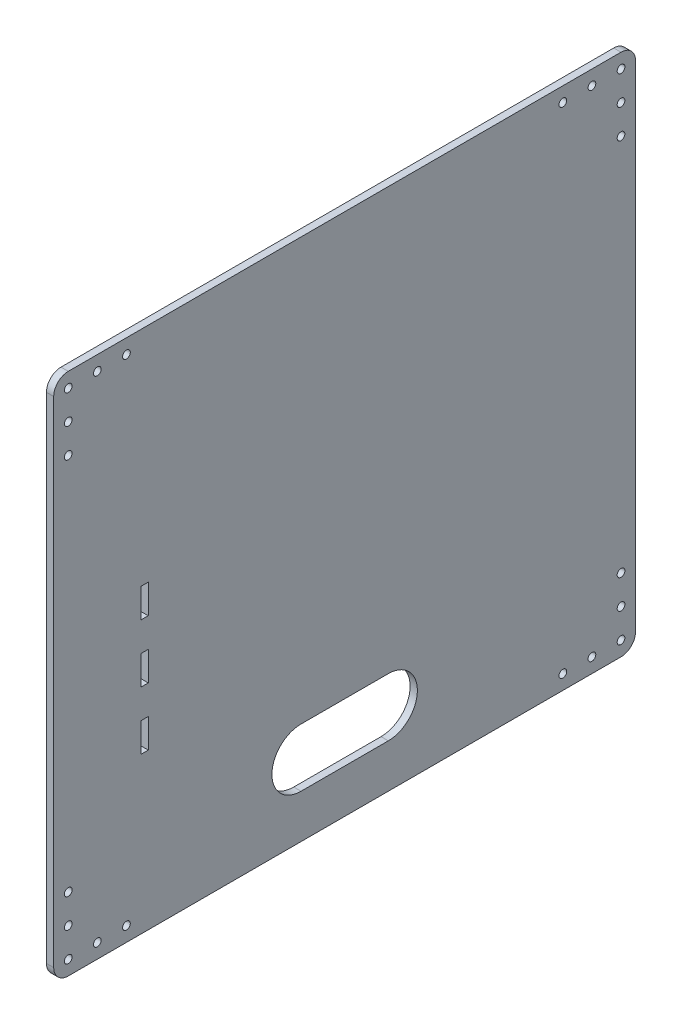
from build123d import *

# Parameters (mm, degrees)
ESBO_O1_W                 = 400
ESBO_O1_H                 = 360
RESSALTO_EXTRUS_O1_DEPTH  = 2.5
FILETE1_R                 = 10
ESBO_O2_R                 = 2.65
CORTE_EXTRUS_O1_DEPTH     = 270.118932816
ESPELHAR2_COPY_1_SKETCH_R = 2.65
ESPELHAR2_COPY_1_DEPTH    = 270.118932816
ESPELHAR2_COPY_2_SKETCH_R = 2.65
ESPELHAR2_COPY_2_DEPTH    = 270.118932816
ESBO_O3_W                 = 5
ESBO_O3_H                 = 20
CORTE_EXTRUS_O2_DEPTH     = 270.118932816
PADR_O_LINEAR1_COUNT      = 3
PADR_O_LINEAR1_PITCH      = 40
CORTE_EXTRUS_O3_DEPTH     = 270.118932816


with BuildPart() as part:
    # Esboço1 → Ressalto-extrusão1 (new, symmetric)
    with BuildSketch(Plane(origin=(0, 0, 0), x_dir=(0, 0, -1), z_dir=(1, 0, 0))):
        Rectangle(ESBO_O1_W, ESBO_O1_H)
    extrude(amount=RESSALTO_EXTRUS_O1_DEPTH, both=True)

    # Filete1
    filete1_edges = [part.edges().sort_by_distance(p)[0] for p in [
        (0, 180, -200),
        (0, -180, -200),
        (0, -180, 200),
        (0, 180, 200),
    ]]
    fillet(filete1_edges, radius=FILETE1_R)

    # Esboço2 → Corte-extrusão1 (cut, through all)
    with BuildSketch(Plane(origin=(2.5, 0, 0), x_dir=(0, 0, -1), z_dir=(1, 0, 0))):
        with Locations((-190, -170)):
            Circle(ESBO_O2_R)
        with Locations((-170, -170)):
            Circle(ESBO_O2_R)
        with Locations((-150, -170)):
            Circle(ESBO_O2_R)
        with Locations((-190, -150)):
            Circle(ESBO_O2_R)
        with Locations((-190, -130)):
            Circle(ESBO_O2_R)
    corte_extrus_o1 = extrude(amount=-CORTE_EXTRUS_O1_DEPTH, mode=Mode.SUBTRACT)

    # Espelhar1: Corte-extrusão1 across plane
    add(corte_extrus_o1.mirror(Plane.XY), mode=Mode.SUBTRACT)

    # Espelhar2 copy 1 sketch → Espelhar2 copy 1 (cut, through all)
    with BuildSketch(Plane(origin=(2.5, 0, 0), x_dir=(0, 0, 1), z_dir=(1, 0, 0))):
        with Locations((-190, -170)):
            Circle(ESPELHAR2_COPY_1_SKETCH_R)
        with Locations((-170, -170)):
            Circle(ESPELHAR2_COPY_1_SKETCH_R)
        with Locations((-150, -170)):
            Circle(ESPELHAR2_COPY_1_SKETCH_R)
        with Locations((-190, -150)):
            Circle(ESPELHAR2_COPY_1_SKETCH_R)
        with Locations((-190, -130)):
            Circle(ESPELHAR2_COPY_1_SKETCH_R)
    extrude(amount=-ESPELHAR2_COPY_1_DEPTH, mode=Mode.SUBTRACT)

    # Espelhar2 copy 2 sketch → Espelhar2 copy 2 (cut, through all)
    with BuildSketch(Plane(origin=(2.5, 0, 0), x_dir=(0, 0, -1), z_dir=(1, 0, 0))):
        with Locations((-190, 170)):
            Circle(ESPELHAR2_COPY_2_SKETCH_R)
        with Locations((-170, 170)):
            Circle(ESPELHAR2_COPY_2_SKETCH_R)
        with Locations((-150, 170)):
            Circle(ESPELHAR2_COPY_2_SKETCH_R)
        with Locations((-190, 150)):
            Circle(ESPELHAR2_COPY_2_SKETCH_R)
        with Locations((-190, 130)):
            Circle(ESPELHAR2_COPY_2_SKETCH_R)
    extrude(amount=-ESPELHAR2_COPY_2_DEPTH, mode=Mode.SUBTRACT)

    # Esboço3 → Corte-extrusão2 (cut, through all)
    with BuildSketch(Plane(origin=(2.5, 0, 0), x_dir=(0, 0, -1), z_dir=(1, 0, 0))):
        with Locations((-137.5, -63)):
            Rectangle(ESBO_O3_W, ESBO_O3_H)
    corte_extrus_o2 = extrude(amount=-CORTE_EXTRUS_O2_DEPTH, mode=Mode.SUBTRACT)

    # Padrão linear1: Corte-extrusão2 ×3
    with Locations(*[(0, i * PADR_O_LINEAR1_PITCH, 0) for i in range(1, PADR_O_LINEAR1_COUNT)]):
        add(corte_extrus_o2, mode=Mode.SUBTRACT)

    # Esboço4 → Corte-extrusão3 (cut, through all)
    with BuildSketch(Plane.ZY.offset(2.5)):
        with BuildLine():
            Line((30, -150), (-30, -150))
            ThreePointArc((-30, -150), (-50, -130), (-30, -110))
            Line((-30, -110), (30, -110))
            ThreePointArc((30, -110), (50, -130), (30, -150))
        make_face()
    extrude(amount=-CORTE_EXTRUS_O3_DEPTH, mode=Mode.SUBTRACT)


solid = part.part
